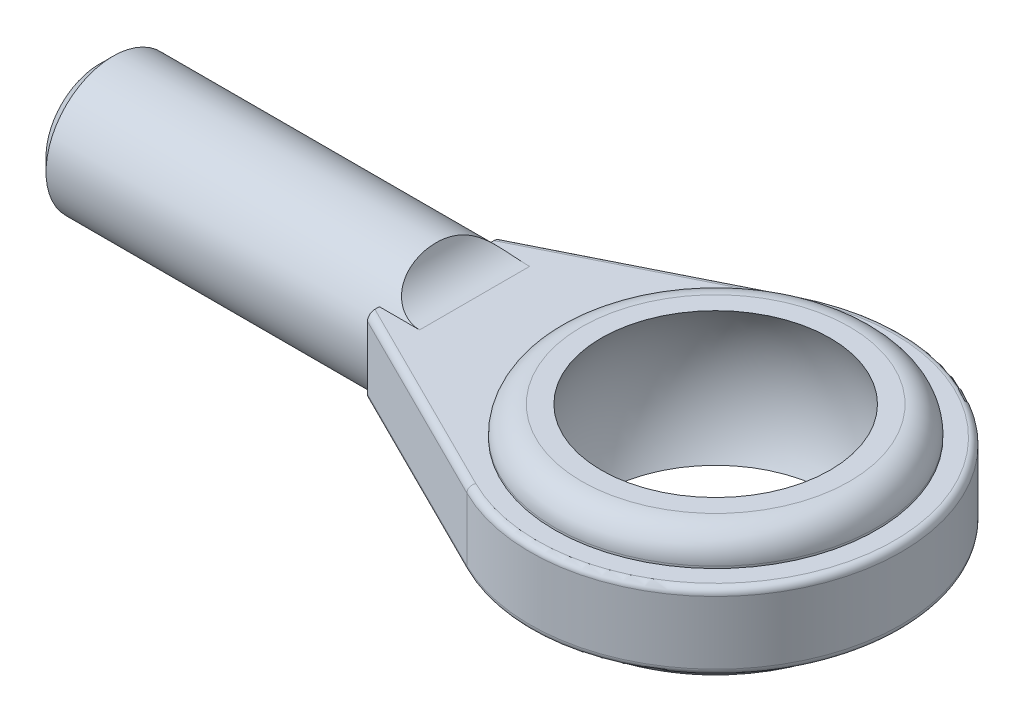
from build123d import *

# Parameters (mm, degrees)
SKETCH1_R           = 5
BOSS_EXTRUDE1_DEPTH = 25
CHAMFER1_SIZE       = 1
SKETCH2_R           = 13.85
BOSS_EXTRUDE2_DEPTH = 2.85
FILLET1_R           = 0.5
FILLET2_R           = 3
SKETCH5_R           = 12
BOSS_EXTRUDE3_DEPTH = 5
FILLET3_R           = 2


with BuildPart() as part:
    # Sketch1 → Boss-Extrude1 (new body)
    with BuildSketch(Plane(origin=(0, 0, 0), x_dir=(0, 0, -1), z_dir=(1, 0, 0))):
        Circle(SKETCH1_R)
    extrude(amount=BOSS_EXTRUDE1_DEPTH)

    # Chamfer1
    chamfer1_edges = [part.edges().sort_by_distance(p)[0] for p in [
        (0, 0, 5),
    ]]
    chamfer(chamfer1_edges, length=CHAMFER1_SIZE)

    # Sketch2 → Boss-Extrude2 (add, symmetric)
    with BuildSketch(Plane(origin=(0, 0, 0), x_dir=(1, 0, 0), z_dir=(0, 1, 0))):
        with BuildLine():
            ThreePointArc((39.816287973, -12.392909488), (32.15, 0), (39.816287973, 12.392909488))
            Line((39.816287973, 12.392909488), (25, 5))
            Line((25, 5), (25, -5))
            Line((25, -5), (39.816287973, -12.392909488))
        make_face()
        with Locations((46, 0)):
            Circle(SKETCH2_R)
    extrude(amount=BOSS_EXTRUDE2_DEPTH, both=True)

    # Fillet1
    fillet1_edges = [part.edges().sort_by_distance(p)[0] for p in [
        (32.408143987, -2.85, 8.696454744),
        (59.85, -2.85, 0),
        (32.408143987, -2.85, -8.696454744),
        (32.408143987, 2.85, 8.696454744),
        (59.85, 2.85, 0),
        (32.408143987, 2.85, -8.696454744),
    ]]
    fillet(fillet1_edges, radius=FILLET1_R)

    # Fillet2
    # the kernel refuses this fillet: 3 mm, written as the material it adds along each edge
    with BuildSketch(Plane(origin=(25, 2.85, -11.60822346), x_dir=(0, 1, 0), z_dir=(0, 0, 1))) as fillet2_piece_1_section:
        with BuildLine():
            CenterArc((FILLET2_R, -FILLET2_R), FILLET2_R, 90, 90)
            Line((0, -FILLET2_R), (0, 0))
            Line((0, 0), (FILLET2_R, 0))
        make_face()
    fillet2_piece_1 = extrude(amount=23.216446921, mode=Mode.PRIVATE)
    fillet2_piece_1 = fillet2_piece_1 & Plane(origin=(25.814581375, 0, 0), x_dir=(0, 0, -1), z_dir=(-1, 0, 0)) * Cylinder(5, 59, mode=Mode.PRIVATE)
    add(fillet2_piece_1)
    with BuildSketch(Plane(origin=(25, -2.85, -11.60822346), x_dir=(1, 0, 0), z_dir=(0, 0, 1))) as fillet2_piece_2_section:
        with BuildLine():
            CenterArc((FILLET2_R, -FILLET2_R), FILLET2_R, 90, 90)
            Line((0, -FILLET2_R), (0, 0))
            Line((0, 0), (FILLET2_R, 0))
        make_face()
    fillet2_piece_2 = extrude(amount=23.216446921, mode=Mode.PRIVATE)
    fillet2_piece_2 = fillet2_piece_2 & Plane(origin=(25.814581711, 0, 0), x_dir=(0, 0, -1), z_dir=(-1, 0, 0)) * Cylinder(5, 59, mode=Mode.PRIVATE)
    add(fillet2_piece_2)

    # Sketch5 → Boss-Extrude3 (add, symmetric)
    with BuildSketch(Plane(origin=(0, 0, 0), x_dir=(1, 0, 0), z_dir=(0, 1, 0))):
        with Locations(Location((46, 0, 0), (0, 0, 270))):
            Circle(SKETCH5_R)
    extrude(amount=BOSS_EXTRUDE3_DEPTH, both=True)

    # Fillet3
    fillet3_edges = [part.edges().sort_by_distance(p)[0] for p in [
        (46, -5, -12),
        (46, 5, -12),
    ]]
    fillet(fillet3_edges, radius=FILLET3_R)

    # Sketch4 → Cut-Revolve1 (revolve, cut)
    with BuildSketch(Plane(origin=(0, 0, 0), x_dir=(1, 0, 0), z_dir=(0, 1, 0))):
        with BuildLine():
            Line((46, 9.9), (46, -9.9))
            ThreePointArc((46, -9.9), (55.9, 0), (46, 9.9))
        make_face()
    revolve(axis=Axis((46, 0, -9.9), (0, 0, 1)), mode=Mode.SUBTRACT)


solid = part.part
